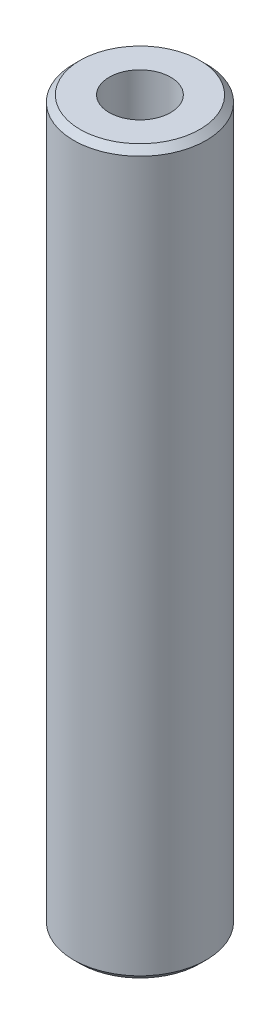
from build123d import *

# Parameters (mm, degrees)
SKETCH1_R           = 55
BOSS_EXTRUDE1_DEPTH = 600
SKETCH2_R           = 25.499323039
CUT_EXTRUDE1_DEPTH  = 606.020660804
CHAMFER1_SIZE       = 5.284251216


with BuildPart() as part:
    # Sketch1 → Boss-Extrude1 (new body)
    with BuildSketch(Plane(origin=(0, 0, 0), x_dir=(1, 0, 0), z_dir=(0, 1, 0))):
        Circle(SKETCH1_R)
    extrude(amount=BOSS_EXTRUDE1_DEPTH)

    # Sketch2 → Cut-Extrude1 (cut, through all)
    with BuildSketch(Plane(origin=(0, 0, 0), x_dir=(1, 0, 0), z_dir=(0, 1, 0))):
        Circle(SKETCH2_R)
    extrude(amount=CUT_EXTRUDE1_DEPTH, mode=Mode.SUBTRACT)

    # Chamfer1
    chamfer1_edges = [part.edges().sort_by_distance(p)[0] for p in [
        (-55, 600, 0),
        (-55, 0, 0),
    ]]
    chamfer(chamfer1_edges, length=CHAMFER1_SIZE)


solid = part.part
